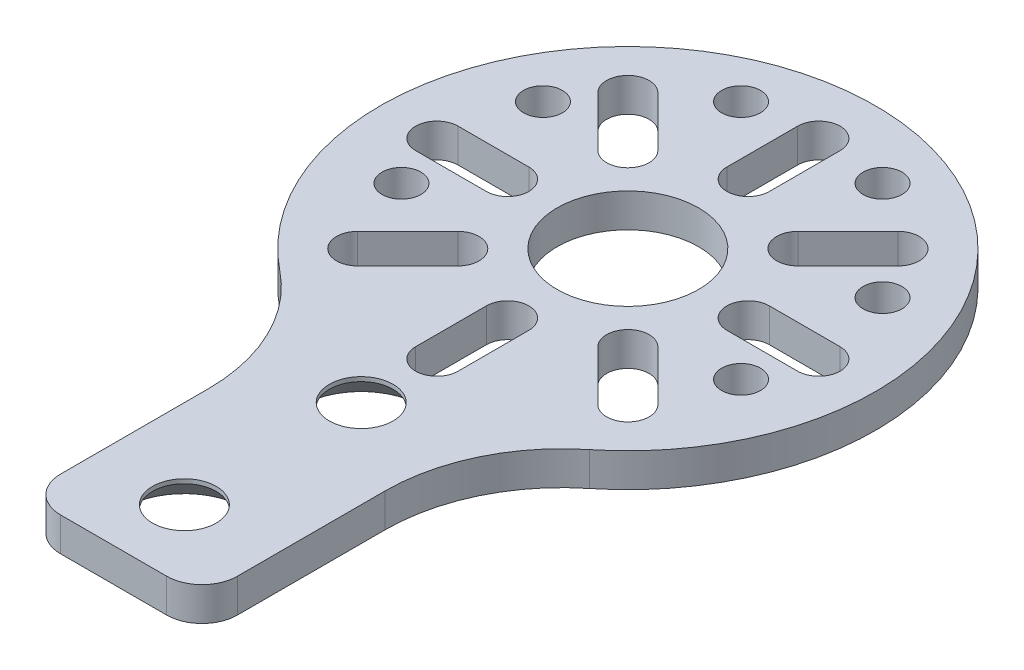
from build123d import *

# Parameters (mm, degrees)
BOSS_EXTRUDE1_DEPTH                            = 4.7625
SKETCH5_R                                      = 10
CUT_EXTRUDE1_DEPTH                             = 81.819371269
CSK_FOR_M8_FLAT_HEAD_MACHINE_SCREW1_AT_2_COUNT = 2
CSK_FOR_M8_FLAT_HEAD_MACHINE_SCREW1_AT_2_PITCH = 25
FILLET1_R                                      = 25
M5_CLEARANCE_HOLE1_D                           = 5.5
M5_CLEARANCE_HOLE1_CSINK_D                     = 5.55
M5_CLEARANCE_HOLE1_CSINK_ANGLE                 = 90
FILLET2_R                                      = 5
CUT_EXTRUDE2_DEPTH                             = 81.819371269


with BuildPart() as part:
    # Sketch1 → Boss-Extrude1 (new body)
    with BuildSketch(Plane(origin=(0, 0, 0), x_dir=(1, 0, 0), z_dir=(0, 1, 0))):
        with BuildLine():
            Line((-12.5, -72.691742077), (12.5, -72.691742077))
            Line((12.5, -72.691742077), (12.5, -32.691742077))
            ThreePointArc((12.5, -32.691742077), (0, 35), (-12.5, -32.691742077))
            Line((-12.5, -32.691742077), (-12.5, -72.691742077))
        make_face()
    extrude(amount=BOSS_EXTRUDE1_DEPTH)

    # Sketch5 → Cut-Extrude1 (cut, through all)
    with BuildSketch(Plane.XZ):
        Circle(SKETCH5_R)
    extrude(amount=-CUT_EXTRUDE1_DEPTH, mode=Mode.SUBTRACT)

    # Sketch8 → CSK for M8 Flat Head Machine Screw1 (revolve, cut)
    with BuildSketch(Plane(origin=(0, 0, 37.691742077), x_dir=(0, 0, -1), z_dir=(1, 0, 0))):
        Polygon((0, 0), (0, 4.7625), (4.5, 4.7625), (4.5, 4.15), (8.65, 0), align=None)
    csk_for_m8_flat_head_machine_screw1 = revolve(axis=Axis((0, -6.35, 37.691742077), (0, 1, 0)), mode=Mode.SUBTRACT)

    # CSK for M8 Flat Head Machine Screw1 at 2: CSK for M8 Flat Head Machine Screw1 ×2
    with Locations(*[(0, 0, i * CSK_FOR_M8_FLAT_HEAD_MACHINE_SCREW1_AT_2_PITCH) for i in range(1, CSK_FOR_M8_FLAT_HEAD_MACHINE_SCREW1_AT_2_COUNT)]):
        add(csk_for_m8_flat_head_machine_screw1, mode=Mode.SUBTRACT)

    # Fillet1
    fillet1_edges = [part.edges().sort_by_distance(p)[0] for p in [
        (-12.5, 2.38125, 32.691742077),
        (12.5, 2.38125, 32.691742077),
    ]]
    fillet(fillet1_edges, radius=FILLET1_R)

    # M5 Clearance Hole1 (through all)
    with Locations(Plane(origin=(0, 0, 0), x_dir=(-1, 0, 0), z_dir=(0, -1, 0))):
        with Locations((10, 26), (24, 12), (24, -8), (-10, 26), (-24, 12), (-24, -8)):
            CounterSinkHole(M5_CLEARANCE_HOLE1_D / 2, M5_CLEARANCE_HOLE1_CSINK_D / 2, counter_sink_angle=M5_CLEARANCE_HOLE1_CSINK_ANGLE)

    # Fillet2
    fillet2_edges = [part.edges().sort_by_distance(p)[0] for p in [
        (-12.5, 2.38125, 72.691742077),
        (12.5, 2.38125, 72.691742077),
    ]]
    fillet(fillet2_edges, radius=FILLET2_R)

    # Sketch12 → Cut-Extrude2 (cut, through all)
    with BuildSketch(Plane(origin=(0, 4.7625, 0), x_dir=(1, 0, 0), z_dir=(0, 1, 0))):
        with BuildLine():
            Line((17, 3), (27, 3))
            ThreePointArc((27, 3), (30, 0), (27, -3))
            Line((27, -3), (17, -3))
            ThreePointArc((17, -3), (14, 0), (17, 3))
        make_face()
        with BuildLine():
            Line((14.142135624, -9.899494937), (21.213203436, -16.970562748))
            ThreePointArc((21.213203436, -16.970562748), (21.213203436, -21.213203436), (16.970562748, -21.213203436))
            Line((16.970562748, -21.213203436), (9.899494937, -14.142135624))
            ThreePointArc((9.899494937, -14.142135624), (9.899494937, -9.899494937), (14.142135624, -9.899494937))
        make_face()
        with BuildLine():
            Line((3, -17), (3, -27))
            ThreePointArc((3, -27), (0, -30), (-3, -27))
            Line((-3, -27), (-3, -17))
            ThreePointArc((-3, -17), (0, -14), (3, -17))
        make_face()
        with BuildLine():
            Line((-9.899494937, -14.142135624), (-16.970562748, -21.213203436))
            ThreePointArc((-16.970562748, -21.213203436), (-21.213203436, -21.213203436), (-21.213203436, -16.970562748))
            Line((-21.213203436, -16.970562748), (-14.142135624, -9.899494937))
            ThreePointArc((-14.142135624, -9.899494937), (-9.899494937, -9.899494937), (-9.899494937, -14.142135624))
        make_face()
        with BuildLine():
            Line((-17, -3), (-27, -3))
            ThreePointArc((-27, -3), (-30, 0), (-27, 3))
            Line((-27, 3), (-17, 3))
            ThreePointArc((-17, 3), (-14, 0), (-17, -3))
        make_face()
        with BuildLine():
            Line((-14.142135624, 9.899494937), (-21.213203436, 16.970562748))
            ThreePointArc((-21.213203436, 16.970562748), (-21.213203436, 21.213203436), (-16.970562748, 21.213203436))
            Line((-16.970562748, 21.213203436), (-9.899494937, 14.142135624))
            ThreePointArc((-9.899494937, 14.142135624), (-9.899494937, 9.899494937), (-14.142135624, 9.899494937))
        make_face()
        with BuildLine():
            Line((-3, 17), (-3, 27))
            ThreePointArc((-3, 27), (0, 30), (3, 27))
            Line((3, 27), (3, 17))
            ThreePointArc((3, 17), (0, 14), (-3, 17))
        make_face()
        with BuildLine():
            Line((9.899494937, 14.142135624), (16.970562748, 21.213203436))
            ThreePointArc((16.970562748, 21.213203436), (21.213203436, 21.213203436), (21.213203436, 16.970562748))
            Line((21.213203436, 16.970562748), (14.142135624, 9.899494937))
            ThreePointArc((14.142135624, 9.899494937), (9.899494937, 9.899494937), (9.899494937, 14.142135624))
        make_face()
    extrude(amount=-CUT_EXTRUDE2_DEPTH, mode=Mode.SUBTRACT)


solid = part.part
